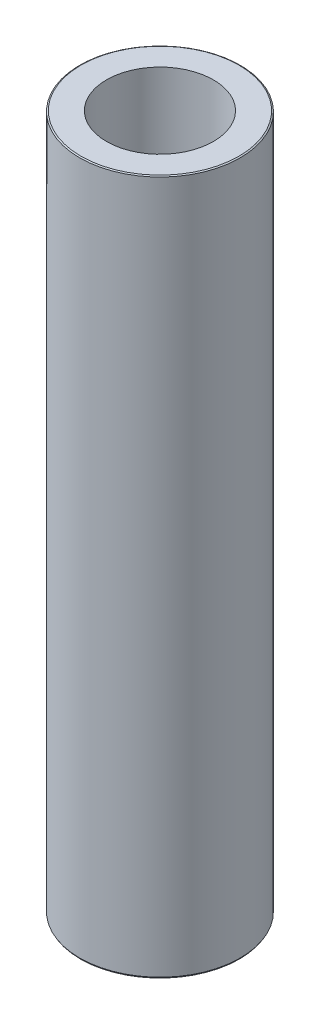
from build123d import *
from OCP.BRepFilletAPI import BRepFilletAPI_MakeChamfer

# Parameters (mm, degrees)
SKETCH1_R           = 22.5
BOSS_EXTRUDE1_DEPTH = 194.857915599
SKETCH2_R           = 14.988095232
CUT_EXTRUDE1_DEPTH  = 198.438869708
CHAMFER1_SIZE       = 0.208134547
CHAMFER1_SIZE2      = 0.36049961


with BuildPart() as part:
    # Sketch1 → Boss-Extrude1 (new body)
    with BuildSketch(Plane(origin=(0, 0, 0), x_dir=(1, 0, 0), z_dir=(0, 1, 0))):
        Circle(SKETCH1_R)
    extrude(amount=BOSS_EXTRUDE1_DEPTH)

    # Sketch2 → Cut-Extrude1 (cut, through all)
    with BuildSketch(Plane(origin=(0, 0, 0), x_dir=(1, 0, 0), z_dir=(0, 1, 0))):
        Circle(SKETCH2_R)
    extrude(amount=CUT_EXTRUDE1_DEPTH, mode=Mode.SUBTRACT)

    # Chamfer1: one chamfer whose edges measure the first distance from different faces: ONE call of the kernel's chamfer builder (chamfer() names one face for all edges)
    chamfer1_edges_1 = [part.edges().sort_by_distance(p)[0] for p in [
        (-22.5, 194.857915599, 0),
    ]]
    chamfer1_side_1 = [part.faces().sort_by_distance(p)[0] for p in [
        (-22.5, 97.4289578, 0),
    ]]
    chamfer1_edges_2 = [part.edges().sort_by_distance(p)[0] for p in [
        (-22.5, 0, 0),
    ]]
    chamfer1_side_2 = [part.faces().sort_by_distance(p)[0] for p in [
        (-21.863603897, 0, 0),
    ]]
    chamfer1 = BRepFilletAPI_MakeChamfer(part.part.solid().wrapped)
    for e in chamfer1_edges_1:
        chamfer1.Add(CHAMFER1_SIZE, CHAMFER1_SIZE2, e.wrapped, chamfer1_side_1[0].wrapped)  # the first distance lies on this face
    for e in chamfer1_edges_2:
        chamfer1.Add(CHAMFER1_SIZE, CHAMFER1_SIZE2, e.wrapped, chamfer1_side_2[0].wrapped)  # the first distance lies on this face
    add(Compound.cast(chamfer1.Shape()), mode=Mode.REPLACE)


solid = part.part
